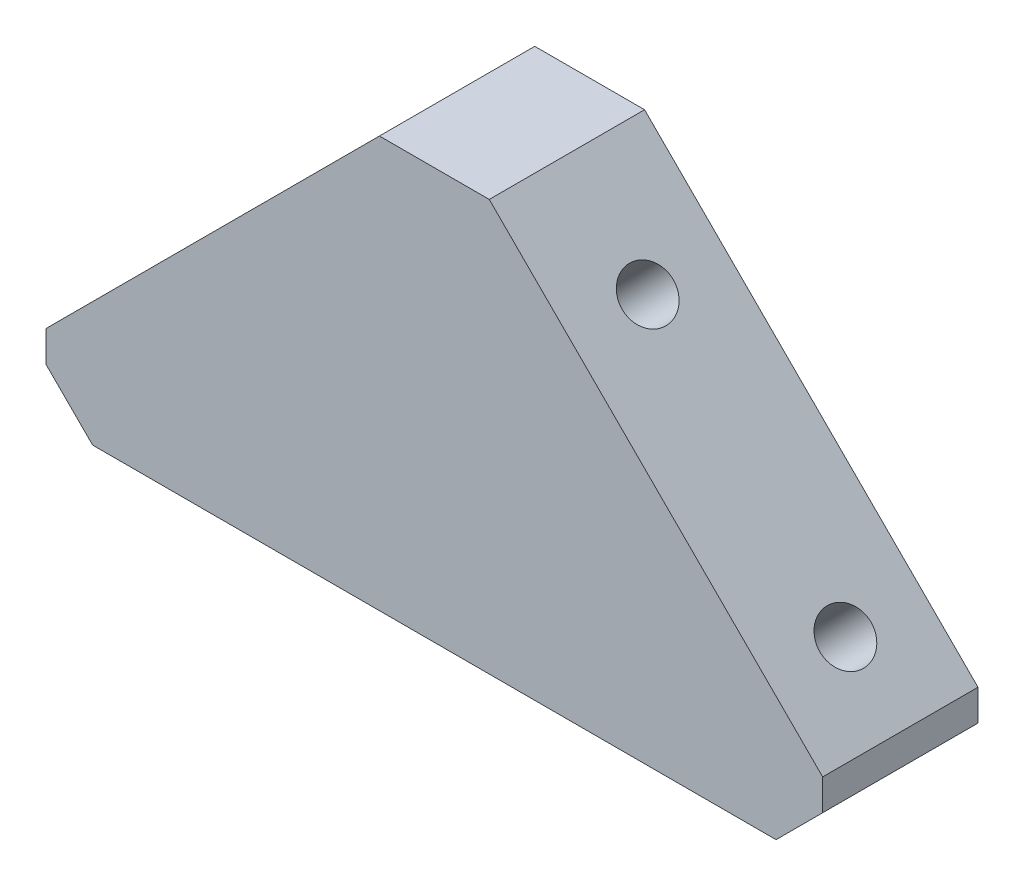
from build123d import *

# Parameters (mm, degrees)
BOSS_EXTRU_1_DEPTH      = 10
ESQUISSE2_R             = 1.65
ENL_V_MAT_EXTRU_1_DEPTH = 8
ESQUISSE3_R             = 1.65
ENL_V_MAT_EXTRU_2_DEPTH = 8
CHANFREIN1_SIZE         = 5
ESQUISSE4_R             = 1.65
ENL_V_MAT_EXTRU_3_DEPTH = 10
CHANFREIN3_SIZE         = 3


with BuildPart() as part:
    # Esquisse1 → Boss.-Extru.1 (new body)
    with BuildSketch(Plane.XY):
        Polygon((-25, 0), (25, 0), (25, 5), (0, 30), (-25, 5), align=None)
    extrude(amount=BOSS_EXTRU_1_DEPTH)

    # Esquisse2 → Enlèv. mat.-Extru.1 (cut)
    with BuildSketch(Plane(origin=(15, 15, 0), x_dir=(0, 0, -1), z_dir=(0.7071067811865511, 0.7071067811865439, 0))):
        with Locations((-5, 8.857864376)):
            Circle(ESQUISSE2_R)
        with Locations((-5, -9.142135624)):
            Circle(ESQUISSE2_R)
    extrude(amount=-ENL_V_MAT_EXTRU_1_DEPTH, mode=Mode.SUBTRACT)

    # Esquisse3 → Enlèv. mat.-Extru.2 (cut)
    with BuildSketch(Plane(origin=(-15, 15, 0), x_dir=(0, 0, 1), z_dir=(-0.7071067811865511, 0.7071067811865439, 0))):
        with Locations((5, 9.857864376)):
            Circle(ESQUISSE3_R)
        with Locations((5, -8.142135624)):
            Circle(ESQUISSE3_R)
    extrude(amount=-ENL_V_MAT_EXTRU_2_DEPTH, mode=Mode.SUBTRACT)

    # Chanfrein1
    chanfrein1_edges = [part.edges().sort_by_distance(p)[0] for p in [
        (0, 30, 5),
    ]]
    chamfer(chanfrein1_edges, length=CHANFREIN1_SIZE)

    # Esquisse4 → Enlèv. mat.-Extru.3 (cut)
    with BuildSketch(Plane.XZ):
        with Locations((0, 5)):
            Circle(ESQUISSE4_R)
        with Locations((-16, 5)):
            Circle(ESQUISSE4_R)
        with Locations((16, 5)):
            Circle(ESQUISSE4_R)
    extrude(amount=-ENL_V_MAT_EXTRU_3_DEPTH, mode=Mode.SUBTRACT)

    # Chanfrein3
    chanfrein3_edges = [part.edges().sort_by_distance(p)[0] for p in [
        (25, 0, 5),
        (-25, 0, 5),
    ]]
    chamfer(chanfrein3_edges, length=CHANFREIN3_SIZE)


solid = part.part
